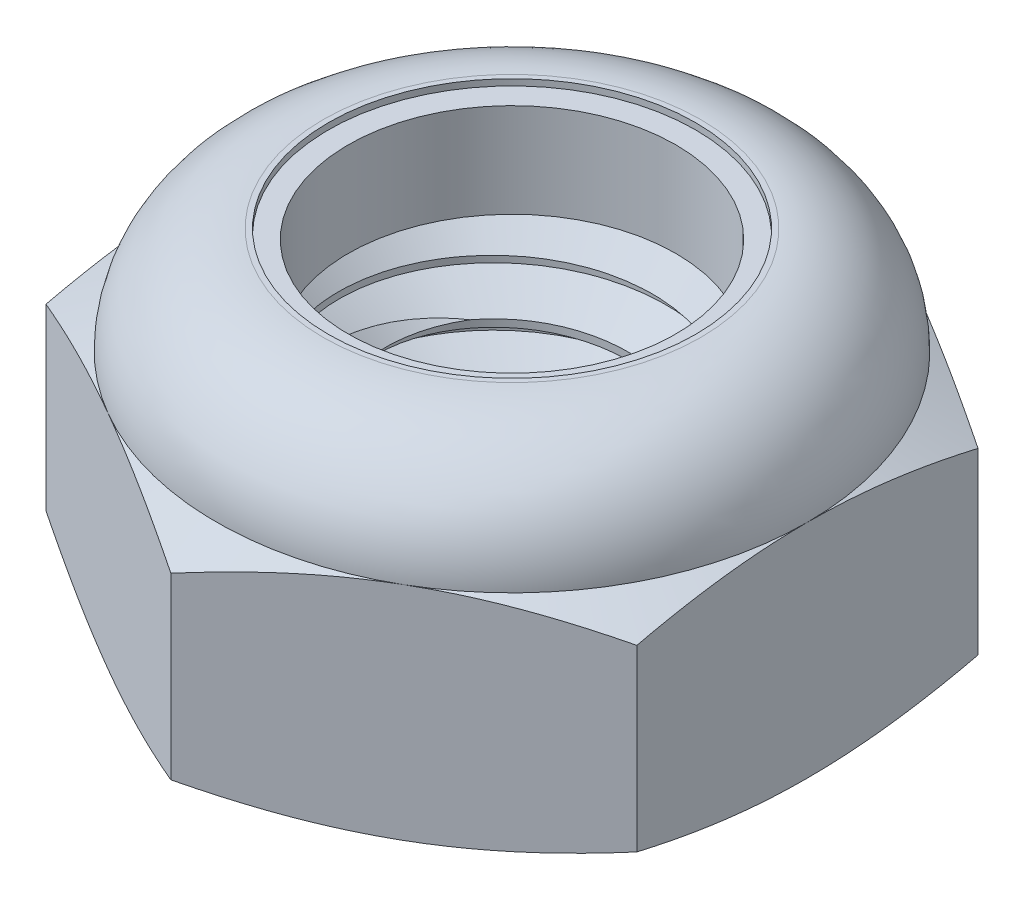
from build123d import *

# Parameters (mm, degrees)
BOSS_EXTRUDE1_DEPTH      = 3.96875
BOSS_EXTRUDE1_DEPTH_BACK = 3.96875
SKETCH9_R                = 3.9624
CUT_EXTRUDE1_DEPTH       = 14.49375
CHAMFER1_SIZE            = 0.310444444
SKETCH13_R               = 4.272844444
BOSS_EXTRUDE3_DEPTH      = 5.3578125
SKETCH15_R               = 3.9624
BOSS_EXTRUDE4_DEPTH      = 5.357812
CUT_SWEEP2_PITCH         = 1.411111111


with BuildPart() as part:
    # Sketch8 → Boss-Extrude1 (new, two sides: drawn at the far end of the back side and taken through both)
    with BuildSketch(Plane(origin=(0, 0, 0), x_dir=(1, 0, 0), z_dir=(0, 1, 0)).offset(-BOSS_EXTRUDE1_DEPTH_BACK)):
        Polygon((7.14375, -4.124445986), (7.14375, 4.124445986), (0, 8.248891971), (-7.14375, 4.124445986), (-7.14375, -4.124445986), (0, -8.248891971), align=None)
    extrude(amount=BOSS_EXTRUDE1_DEPTH + BOSS_EXTRUDE1_DEPTH_BACK)

    # Sketch9 → Cut-Extrude1 (cut, through all)
    with BuildSketch(Plane(origin=(0, 3.96875, 0), x_dir=(1, 0, 0), z_dir=(0, 1, 0))):
        with Locations(Location((0, 0, 0), (0, 0, 270))):
            Circle(SKETCH9_R)
    extrude(amount=-CUT_EXTRUDE1_DEPTH, mode=Mode.SUBTRACT)

    # Sketch5 → Cut-Revolve2 (revolve, cut)
    with BuildSketch(Plane(origin=(0, 0, 0), x_dir=(0, 0, -1), z_dir=(1, 0, 0))):
        with BuildLine():
            Line((0, -3.96875), (7.14375, -3.96875))
            Line((7.14375, -3.96875), (8.248891971, -3.453413836))
            Line((8.248891971, -3.453413836), (8.248891971, 0.873726336))
            Line((8.248891971, 0.873726336), (7.14375, 1.3890625))
            ThreePointArc((7.14375, 1.3890625), (6.388177025, 3.213177025), (4.5640625, 3.96875))
            Line((4.5640625, 3.96875), (4.5640625, 5.23875))
            Line((4.5640625, 5.23875), (9.518891971, 5.23875))
            Line((9.518891971, 5.23875), (9.518891971, -5.23875))
            Line((9.518891971, -5.23875), (0, -5.23875))
            Line((0, -5.23875), (0, -3.96875))
        make_face()
    revolve(axis=Axis((0, -3.96875, 0), (0, 1, 0)), mode=Mode.SUBTRACT)

    # Sketch6 → Cut-Revolve3 (revolve, cut)
    with BuildSketch(Plane(origin=(0, 0, 0), x_dir=(0, 0, -1), z_dir=(1, 0, 0))):
        with BuildLine():
            Line((0, 1.3890625), (6.99135, 1.3890625))
            ThreePointArc((6.99135, 1.3890625), (6.280413951, 3.105413951), (4.5640625, 3.81635))
            Line((4.5640625, 3.81635), (4.437888, 3.81635))
            Line((4.437888, 3.81635), (4.437888, 5.23875))
            Line((4.437888, 5.23875), (0, 5.23875))
            Line((0, 5.23875), (0, 1.3890625))
        make_face()
    revolve(axis=Axis((0, 5.23875, 0), (0, 1, 0)), mode=Mode.SUBTRACT)

    # Chamfer1
    chamfer1_edges = [part.edges().sort_by_distance(p)[0] for p in [
        (0, -3.96875, -3.9624),
    ]]
    chamfer(chamfer1_edges, length=CHAMFER1_SIZE)

    # Sketch13 → Boss-Extrude3 (add)
    with BuildSketch(Plane.XZ.offset(3.96875)):
        Circle(SKETCH13_R)
    extrude(amount=-BOSS_EXTRUDE3_DEPTH)


with BuildPart() as body_2:
    # Sketch7 → Revolve1 (revolve)
    with BuildSketch(Plane(origin=(0, 0, 0), x_dir=(0, 0, -1), z_dir=(1, 0, 0))):
        with BuildLine():
            Line((3.9624, 1.4652625), (6.913914834, 1.4652625))
            ThreePointArc((6.913914834, 1.4652625), (6.199369744, 3.078258359), (4.5640625, 3.74015))
            Line((4.5640625, 3.74015), (3.9624, 3.74015))
            Line((3.9624, 3.74015), (3.9624, 1.4652625))
        make_face()
    revolve(axis=Axis((0, 1.4652625, 0), (0, 1, 0)))


with BuildPart() as body_3:
    # Sketch15 → Boss-Extrude4 (new body)
    with BuildSketch(Plane.XZ.offset(3.96875)):
        with Locations(Location((0, 0, 0), (0, 0, 270))):
            Circle(SKETCH15_R)
    extrude(amount=-BOSS_EXTRUDE4_DEPTH)

    # Cut-Sweep2: the profile of Sketch12 screwed along a right-hand helix of 5.625 turns, 8 arcs to a turn; built about Z, then put on its axis
    cut_sweep2_z = Axis((0, 0, 0), (0, 0, 1))
    cut_sweep2_corners = [(3.045856448, 0, -0.529166667), (4.038778629, 0, 0.044097222), (4.038778629, 0, -1.278819444), (3.045856448, 0, -0.705555556)]
    with BuildLine(mode=Mode.PRIVATE) as cut_sweep2_profile:
        Line(cut_sweep2_corners[0], cut_sweep2_corners[1])
        Line(cut_sweep2_corners[1], cut_sweep2_corners[2])
        Line(cut_sweep2_corners[2], cut_sweep2_corners[3])
        Line(cut_sweep2_corners[3], cut_sweep2_corners[0])
    cut_sweep2_cap = Face(cut_sweep2_profile.wire())
    cut_sweep2_turn_angles = [0, 22.5, 45, 67.5, 90, 112.5, 135, 157.5, 180, 202.5, 225, 247.5, 270, 292.5, 315, 337.5, 360]
    cut_sweep2_turn_weights = [1, 0.9238795325112867, 1, 0.9238795325112867, 1, 0.9238795325112867, 1, 0.9238795325112867, 1, 0.9238795325112867, 1, 0.9238795325112867, 1, 0.9238795325112867, 1, 0.9238795325112867, 1]
    cut_sweep2_turn_rails = [Edge.make_bspline([Vector(p[0], p[1], 0).rotate(cut_sweep2_z, cut_sweep2_turn_angles[k]) / cut_sweep2_turn_weights[k] + Vector(0, 0, p[2] + CUT_SWEEP2_PITCH * cut_sweep2_turn_angles[k] / 360) for k in range(17)], [0, 0, 0, 1, 1, 2, 2, 3, 3, 4, 4, 5, 5, 6, 6, 7, 7, 8, 8, 8], 2, cut_sweep2_turn_weights) for p in cut_sweep2_corners]
    cut_sweep2_turn_sides = [Face.make_surface_from_curves(cut_sweep2_turn_rails[p[0]], cut_sweep2_turn_rails[p[1]]) for p in [(0, 1), (1, 2), (2, 3), (3, 0)]]
    cut_sweep2_last_angles = [1800, 1822.5, 1845, 1867.5, 1890, 1912.5, 1935, 1957.5, 1980, 2002.5, 2025]
    cut_sweep2_last_weights = [1, 0.9238795325112867, 1, 0.9238795325112867, 1, 0.9238795325112867, 1, 0.9238795325112867, 1, 0.9238795325113225, 1]
    cut_sweep2_last_rails = [Edge.make_bspline([Vector(p[0], p[1], 0).rotate(cut_sweep2_z, cut_sweep2_last_angles[k]) / cut_sweep2_last_weights[k] + Vector(0, 0, p[2] + CUT_SWEEP2_PITCH * cut_sweep2_last_angles[k] / 360) for k in range(11)], [0, 0, 0, 1, 1, 2, 2, 3, 3, 4, 4, 5, 5, 5], 2, cut_sweep2_last_weights) for p in cut_sweep2_corners]
    cut_sweep2_last_sides = [Face.make_surface_from_curves(cut_sweep2_last_rails[p[0]], cut_sweep2_last_rails[p[1]]) for p in [(0, 1), (1, 2), (2, 3), (3, 0)]]
    cut_sweep2 = Plane(origin=(0, -3.96875, 0), x_dir=(0, 0, -1), z_dir=(0, 1, 0)) * Solid(Shell([*[p.moved(Location((0, 0, CUT_SWEEP2_PITCH * i))) for i in range(5) for p in cut_sweep2_turn_sides], *cut_sweep2_last_sides, cut_sweep2_cap, cut_sweep2_cap.rotate(cut_sweep2_z, 2025).moved(Location((0, 0, CUT_SWEEP2_PITCH * 2025 / 360)))]))
    add(cut_sweep2, mode=Mode.SUBTRACT)


with BuildPart() as part_1:
    add(part.part)

    # Combine1: cut body 3
    add(body_3.part, mode=Mode.SUBTRACT)

    # Cut-Extrude2 cone 1 section (through the dimple's axis) → Cut-Extrude2 (revolve, cut)
    with BuildSketch(Plane(origin=(0, -3.96875, 0), x_dir=(0, 0, -1), z_dir=(1, 0, 0))):
        Polygon((0, 0), (4.4704, 0), (0, 4.4704), align=None)
    revolve(axis=Axis((0, -3.96875, 0), (0, 1, 0)), mode=Mode.SUBTRACT)

    # Cut-Extrude3 cone 1 section (through the dimple's axis) → Cut-Extrude3 (revolve, cut)
    with BuildSketch(Plane(origin=(0, 1.3890625, 0), x_dir=(0, 0, 1), z_dir=(1, 0, 0))):
        Polygon((0, 0), (4.4704, 0), (0, 4.4704), align=None)
    revolve(axis=Axis((0, 1.3890625, 0), (0, -1, 0)), mode=Mode.SUBTRACT)


solid = Compound([body_2.part, part_1.part])
